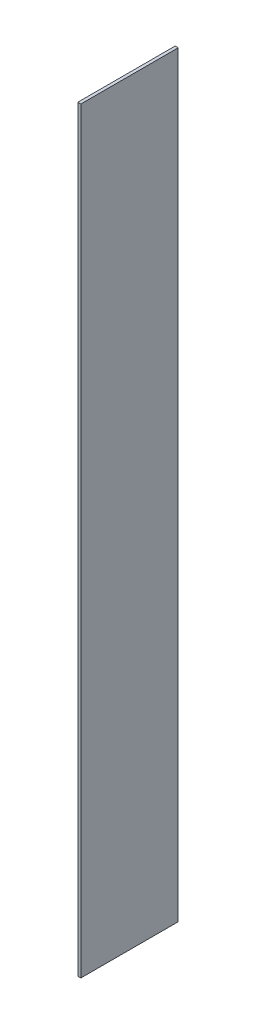
from build123d import *

# Parameters (mm, degrees)
PROFILE_SKETCH_W      = 0.55
PROFILE_SKETCH_H      = 17.5
PROFILE_EXTRUDE_DEPTH = 136


with BuildPart() as part:
    # Profile Sketch → Profile Extrude (new body)
    with BuildSketch(Plane(origin=(0.045617437, 0, -0.024209872), x_dir=(-1, 0, 0), z_dir=(0, 1, 0))):
        with Locations((0.320617437, -8.725790128)):
            Rectangle(PROFILE_SKETCH_W, PROFILE_SKETCH_H)
    extrude(amount=PROFILE_EXTRUDE_DEPTH)


solid = part.part
